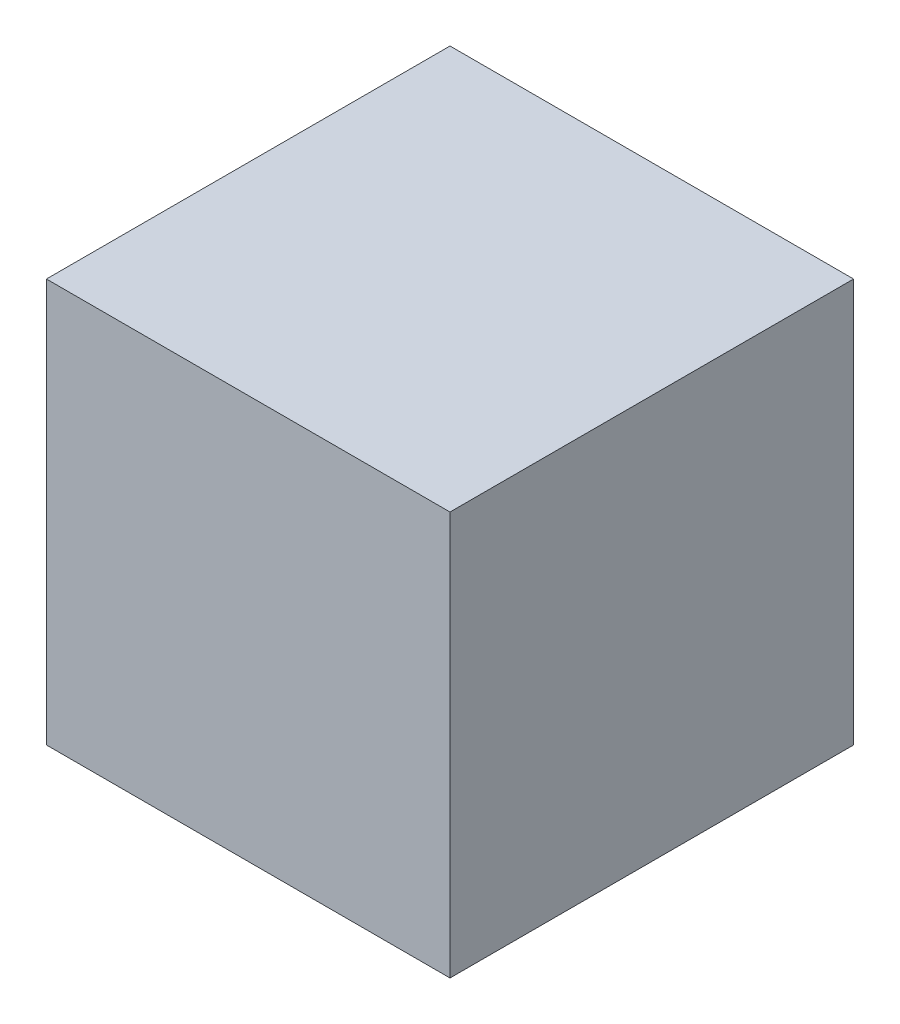
from build123d import *

# Parameters (mm, degrees)
SKETCH1_W      = 100
SKETCH1_H      = 100
EXTRUDE1_DEPTH = 100


with BuildPart() as part:
    # Sketch1 → Extrude1 (new body)
    with BuildSketch(Plane.XY):
        with Locations((50, 50)):
            Rectangle(SKETCH1_W, SKETCH1_H)
    extrude(amount=EXTRUDE1_DEPTH)


solid = part.part
